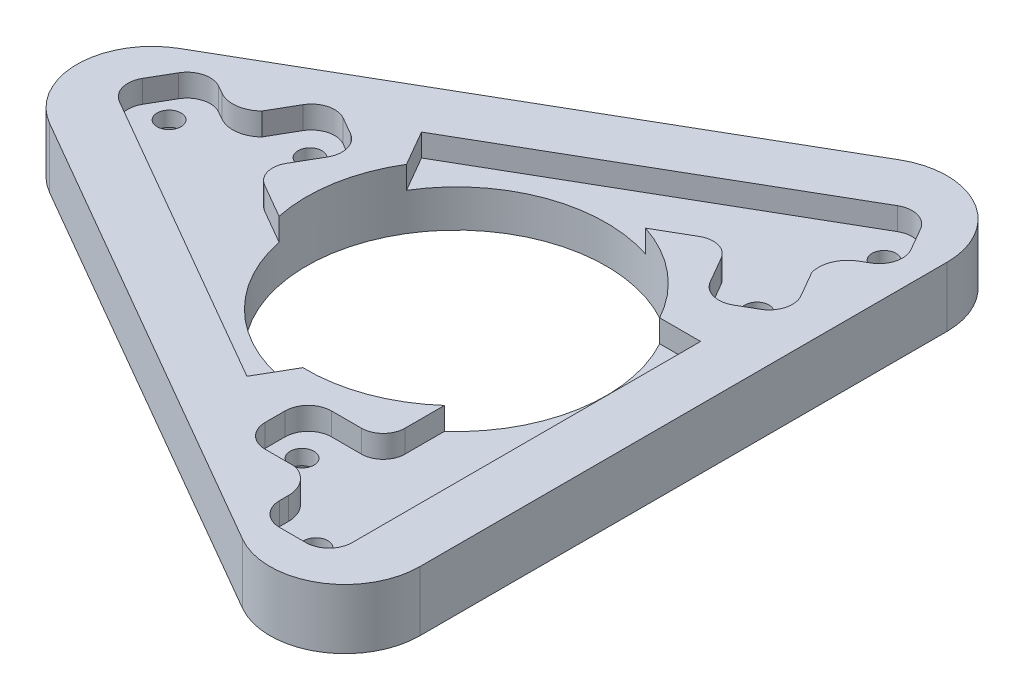
from build123d import *

# Parameters (mm, degrees)
ESQUISSE5_R             = 20
BOSS_EXTRU_1_DEPTH      = 8
ENL_V_MAT_EXTRU_1_DEPTH = 3
D_GAGEMENT_M32_D        = 3.2
ENL_V_MAT_EXTRU_3_DEPTH = 3
CONG_1_R                = 10


with BuildPart() as part:
    # Esquisse5 → Boss.-Extru.1 (new body)
    with BuildSketch(Plane(origin=(0, 0, 0), x_dir=(1, 0, 0), z_dir=(0, 1, 0))):
        Polygon((30.310889132, -52.5), (30.310889132, 52.5), (-60.621778265, 0), align=None)
        Circle(ESQUISSE5_R, mode=Mode.SUBTRACT)
    extrude(amount=BOSS_EXTRU_1_DEPTH)

    # Esquisse8 → Enlèv. mat.-Extru.1 (cut)
    with BuildSketch(Plane(origin=(0, 8, 0), x_dir=(1, 0, 0), z_dir=(0, 1, 0))):
        with BuildLine():
            Line((-32.867987122, 6.955244868), (-30.874578079, 10.407930611))
            ThreePointArc((-30.874578079, 10.407930611), (-28.992238367, 11.852300672), (-26.639899327, 11.542609363))
            Line((-26.639899327, 11.542609363), (-24.33605175, 10.212482344))
            ThreePointArc((-24.33605175, 10.212482344), (-22.891681689, 8.330142632), (-23.201372998, 5.977803592))
            Line((-23.201372998, 5.977803592), (-25.201372998, 2.513701977))
            ThreePointArc((-25.201372998, 2.513701977), (-25.491084224, 0.313126746), (-24.139899327, -1.447771694))
            Line((-24.139899327, -1.447771694), (1.629389115, -16.325677313))
            Line((1.629389115, -16.325677313), (-3.220610885, -24.72612373))
            Line((-3.220610885, -24.72612373), (-43.480280384, -1.482192707))
            ThreePointArc((-43.480280384, -1.482192707), (-44.924650446, 0.400147005), (-44.614959136, 2.752486045))
            Line((-44.614959136, 2.752486045), (-42.864959136, 5.783574958))
            ThreePointArc((-42.864959136, 5.783574958), (-40.982619424, 7.227945019), (-38.630280384, 6.91825371))
            Line((-38.630280384, 6.91825371), (-37.61925313, 6.334536852))
            ThreePointArc((-37.61925313, 6.334536852), (-35.138441271, 5.839789742), (-32.867987122, 6.955244868))
        make_face()
        with BuildLine():
            Line((22.457412307, 24.986889385), (24.450821349, 21.534203642))
            ThreePointArc((24.450821349, 21.534203642), (24.760512659, 19.181864602), (23.316142598, 17.299524891))
            Line((23.316142598, 17.299524891), (21.01229502, 15.969397872))
            ThreePointArc((21.01229502, 15.969397872), (18.659955981, 15.659706562), (16.777616269, 17.104076623))
            Line((16.777616269, 17.104076623), (14.777616269, 20.568178239))
            ThreePointArc((14.777616269, 20.568178239), (13.016717829, 21.919363135), (10.816142598, 21.629651909))
            Line((10.816142598, 21.629651909), (-14.953145845, 6.75174629))
            Line((-14.953145845, 6.75174629), (-19.803145845, 15.152192707))
            Line((-19.803145845, 15.152192707), (20.456523655, 38.39612373))
            ThreePointArc((20.456523655, 38.39612373), (22.808862694, 38.70581504), (24.691202406, 37.261444978))
            Line((24.691202406, 37.261444978), (26.441202406, 34.230356065))
            ThreePointArc((26.441202406, 34.230356065), (26.750893716, 31.878017025), (25.306523655, 29.995677313))
            Line((25.306523655, 29.995677313), (24.2954964, 29.411960456))
            ThreePointArc((24.2954964, 29.411960456), (22.626626905, 27.510887919), (22.457412307, 24.986889385))
        make_face()
        with BuildLine():
            Line((10.410574816, -31.942134253), (6.42375673, -31.942134253))
            ThreePointArc((6.42375673, -31.942134253), (4.231725708, -31.034165275), (3.32375673, -28.842134253))
            Line((3.32375673, -28.842134253), (3.32375673, -26.181880215))
            ThreePointArc((3.32375673, -26.181880215), (4.231725708, -23.989849194), (6.42375673, -23.081880215))
            Line((6.42375673, -23.081880215), (10.42375673, -23.081880215))
            ThreePointArc((10.42375673, -23.081880215), (12.474366395, -22.232489881), (13.32375673, -20.181880215))
            Line((13.32375673, -20.181880215), (13.32375673, 9.573931023))
            Line((13.32375673, 9.573931023), (23.02375673, 9.573931023))
            Line((23.02375673, 9.573931023), (23.02375673, -36.913931023))
            ThreePointArc((23.02375673, -36.913931023), (22.115787751, -39.105962045), (19.92375673, -40.013931023))
            Line((19.92375673, -40.013931023), (16.42375673, -40.013931023))
            ThreePointArc((16.42375673, -40.013931023), (14.231725708, -39.105962045), (13.32375673, -36.913931023))
            Line((13.32375673, -36.913931023), (13.32375673, -35.746497308))
            ThreePointArc((13.32375673, -35.746497308), (12.511814366, -33.350677661), (10.410574816, -31.942134253))
        make_face()
    extrude(amount=-ENL_V_MAT_EXTRU_1_DEPTH, mode=Mode.SUBTRACT)

    # Dégagement M32 (through all)
    with Locations(Plane(origin=(0, 5, 0), x_dir=(1, 0, 0), z_dir=(0, 1, 0))):
        with Locations((-41.055280384, 2.718030501), (-27.287975539, 7.7598544), (20.364218809, 19.752152835), (22.881523655, 34.195900522), (6.92375673, -27.512007234), (18.17375673, -36.913931023)):
            Hole(D_GAGEMENT_M32_D / 2)

    # Esquisse15 → Enlèv. mat.-Extru.3 (cut)
    with BuildSketch(Plane(origin=(0, 0, 0), x_dir=(-1, 0, 0), z_dir=(0, -1, 0))):
        Polygon((40.290478063, -0.42337217), (43.39341374, 0.484990927), (44.158216062, 3.626393598), (41.820082706, 5.859433173), (38.717147028, 4.951070076), (37.952344707, 1.809667405), align=None)
        Polygon((-25.900178533, 35.353940269), (-25.393742933, 32.160688585), (-22.375088055, 31.002648838), (-19.862868776, 33.037860775), (-20.369304376, 36.231112459), (-23.387959255, 37.389152205), align=None)
        Polygon((-21.263857606, -37.865040852), (-18.895121894, -40.065591797), (-15.805021018, -39.114481968), (-15.083655853, -35.962821194), (-17.452391565, -33.762270249), (-20.542492442, -34.713380078), align=None)
        Polygon((-3.690595222, -27.512007234), (-5.307175976, -24.712007234), (-8.540337483, -24.712007234), (-10.156918237, -27.512007234), (-8.540337483, -30.312007234), (-5.307175976, -30.312007234), align=None)
        Polygon((29.932457529, 5.899733883), (30.221128155, 9.119982725), (27.576646165, 10.980103241), (24.643493548, 9.619974916), (24.354822922, 6.399726074), (26.999304913, 4.539605558), align=None)
        Polygon((-17.719736819, 21.612273351), (-20.652889435, 22.972401677), (-23.297371426, 21.11228116), (-23.0087008, 17.892032319), (-20.075548183, 16.531903993), (-17.431066193, 18.392024509), align=None)
    extrude(amount=-ENL_V_MAT_EXTRU_3_DEPTH, mode=Mode.SUBTRACT)

    # Congé1
    cong_1_edges = [part.edges().sort_by_distance(p)[0] for p in [
        (30.310889132, 4, -52.5),
        (30.310889132, 4, 52.5),
        (-60.621778265, 4, 0),
    ]]
    fillet(cong_1_edges, radius=CONG_1_R)


solid = part.part
